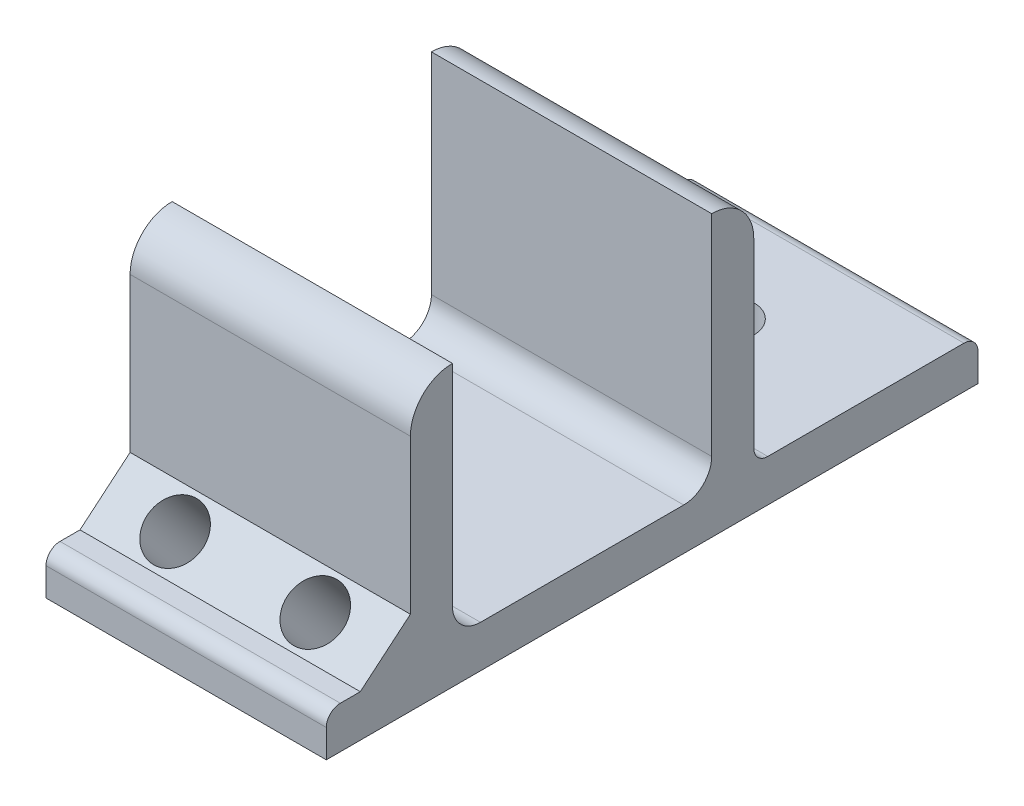
from build123d import *

# Parameters (mm, degrees)
RESSALTO_EXTRUS_O1_DEPTH = 20
FILETE12_R               = 2
CHANFRO1_SIZE            = 3
CHANFRO1_SIZE2           = 3.575260778
ESBO_O3_R                = 2
CORTE_EXTRUS_O1_DEPTH    = 43.712437978
ESBO_O4_R                = 2
CORTE_EXTRUS_O2_DEPTH    = 10


with BuildPart() as part:
    # Esboço2 → Ressalto-extrusão1 (new body)
    with BuildSketch(Plane(origin=(0, 0, 0), x_dir=(0, 0, -1), z_dir=(1, 0, 0))):
        with BuildLine():
            Line((-18.25, 0), (18.25, 0))
            Line((18.25, 0), (28.25, 0))
            Line((28.25, 0), (28.25, 2))
            ThreePointArc((28.25, 2), (27.957106781, 2.707106781), (27.25, 3))
            Line((27.25, 3), (13.25, 3))
            ThreePointArc((13.25, 3), (12.542893219, 3.292893219), (12.25, 4))
            Line((12.25, 4), (12.25, 17))
            ThreePointArc((12.25, 17), (11.371320344, 19.121320344), (9.25, 20))
            Line((9.25, 20), (9.25, 3))
            Line((9.25, 3), (-9.25, 3))
            Line((-9.25, 3), (-9.25, 20))
            ThreePointArc((-9.25, 20), (-11.371320344, 19.121320344), (-12.25, 17))
            Line((-12.25, 17), (-12.25, 3))
            Line((-12.25, 3), (-17.25, 3))
            ThreePointArc((-17.25, 3), (-17.957106781, 2.707106781), (-18.25, 2))
            Line((-18.25, 2), (-18.25, 0))
        make_face()
    extrude(amount=RESSALTO_EXTRUS_O1_DEPTH)

    # Filete12
    filete12_edges = [part.edges().sort_by_distance(p)[0] for p in [
        (10, 3, 9.25),
        (10, 3, -9.25),
    ]]
    fillet(filete12_edges, radius=FILETE12_R)

    # Chanfro1
    chanfro1_edges = [part.edges().sort_by_distance(p)[0] for p in [
        (10, 3, 12.25),
    ]]
    chanfro1_side = [part.faces().sort_by_distance(p)[0] for p in [
        (10, 10, 12.25),
    ]]
    chamfer(chanfro1_edges, length=CHANFRO1_SIZE, length2=CHANFRO1_SIZE2, reference=chanfro1_side[0])

    # Esboço3 → Corte-extrusão1 (cut, through all)
    with BuildSketch(Plane(origin=(0, 9.55289202, 8.015828171), x_dir=(1, 0, 0), z_dir=(0, 0.7660444431189817, 0.6427876096865351))):
        with Locations((5, -7.86090451)):
            Circle(ESBO_O3_R)
        with Locations((15, -7.86090451)):
            Circle(ESBO_O3_R)
    extrude(amount=-CORTE_EXTRUS_O1_DEPTH, mode=Mode.SUBTRACT)

    # Esboço4 → Corte-extrusão2 (cut)
    with BuildSketch(Plane(origin=(0, 3, 0), x_dir=(1, 0, 0), z_dir=(0, 1, 0))):
        with Locations((10, 20.25)):
            Circle(ESBO_O4_R)
    extrude(amount=-CORTE_EXTRUS_O2_DEPTH, mode=Mode.SUBTRACT)


solid = part.part
